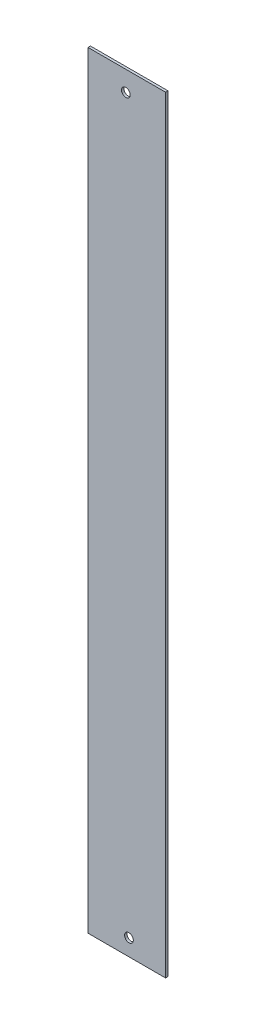
from build123d import *

# Parameters (mm, degrees)
SKETCH1_W          = 44.5
SKETCH1_H          = 440
BASE_FLANGE1_DEPTH = 1.4
CUT_EXTRUDE1_REACH = 444.247
SKETCH6_R          = 2.5


# Sheet-metal steps are written as plain solids
with BuildPart() as part:
    # Sketch1 → Base-Flange1 (new body)
    with BuildSketch(Plane.XY):
        with Locations((22.25, 220)):
            Rectangle(SKETCH1_W, SKETCH1_H)
    extrude(amount=-BASE_FLANGE1_DEPTH)

    # Sketch6 → Cut-Extrude1 (cut, up to next)
    with BuildSketch(Plane.XY, mode=Mode.PRIVATE) as cut_extrude1_sk1:
        with Locations((21.7, 428.5)):
            Circle(SKETCH6_R)
    cut_extrude1_tool1 = extrude(cut_extrude1_sk1.sketch, amount=-CUT_EXTRUDE1_REACH, mode=Mode.PRIVATE) & part.part
    # Sketch6 → Cut-Extrude1 (cut, up to next)
    with BuildSketch(Plane.XY, mode=Mode.PRIVATE) as cut_extrude1_sk2:
        with Locations((23.5, 9.5)):
            Circle(SKETCH6_R)
    cut_extrude1_tool2 = extrude(cut_extrude1_sk2.sketch, amount=-CUT_EXTRUDE1_REACH, mode=Mode.PRIVATE) & part.part
    add(cut_extrude1_tool1.solids().sort_by_distance((21.7, 428.5, 0))[0], mode=Mode.SUBTRACT)
    add(cut_extrude1_tool2.solids().sort_by_distance((23.5, 9.5, 0))[0], mode=Mode.SUBTRACT)


solid = part.part
